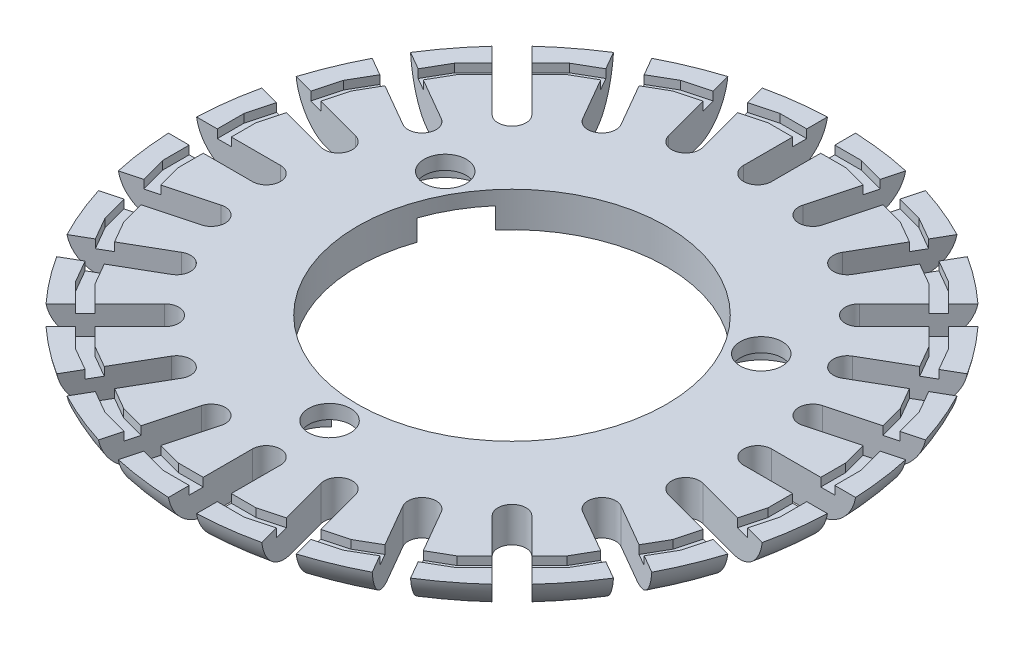
from build123d import *

# Parameters (mm, degrees)
ESBO_O1_R                = 23.5
RESSALTO_EXTRUS_O1_DEPTH = 2.5
FILETE1_R                = 3
CORTE_EXTRUS_O1_DEPTH    = 34.327916234
PADR_OCIRCULAR1_COUNT    = 24
CORTE_EXTRUS_O2_DEPTH    = 0.6
PADR_OCIRCULAR2_COUNT    = 24
ESBO_O5_R                = 11
CORTE_EXTRUS_O3_DEPTH    = 34.29789798
ESBO_O6_R                = 1.5
CORTE_EXTRUS_O5_DEPTH    = 2.5
ESBO_O8_R                = 3
CORTE_EXTRUS_O6_DEPTH    = 1.5


with BuildPart() as part:
    # Esboço1 → Ressalto-extrusão1 (new body)
    with BuildSketch(Plane(origin=(0, 0, 0), x_dir=(1, 0, 0), z_dir=(0, 1, 0))):
        with Locations(Location((0, 0, 0), (0, 0, 270))):
            Circle(ESBO_O1_R)
    extrude(amount=RESSALTO_EXTRUS_O1_DEPTH)

    # Filete1
    # the kernel refuses this fillet: 3 mm, written as the material it takes off along each edge
    with BuildSketch(Plane(origin=(0, 0, 0), x_dir=(0, 0, 1), z_dir=(-1, 0, 0))) as filete1_piece_1:
        with BuildLine():
            CenterArc((20.541960108, 3), FILETE1_R, 270, 80.405931773)
            Line((20.541960108, 0), (20.541960108, -0.06))
            Line((20.541960108, -0.06), (23.5, -0.06))
            Line((23.5, -0.06), (23.56, 0))
            ThreePointArc((23.56, 0), (23.56, 1.25), (23.559160798, 2.49))
            Line((23.559160798, 2.49), (23.5, 2.5))
        make_face()
    revolve(axis=Axis((0, 0, 0), (0, 1, 0)), mode=Mode.SUBTRACT)

    # Esboço2 → Corte-extrusão1 (cut, through all)
    with BuildSketch(Plane(origin=(0, 2.5, 0), x_dir=(1, 0, 0), z_dir=(0, 1, 0))):
        with BuildLine():
            Line((1, 17.5), (1, 23.5))
            Line((1, 23.5), (-1, 23.5))
            Line((-1, 23.5), (-1, 17.5))
            ThreePointArc((-1, 17.5), (0, 16.5), (1, 17.5))
        make_face()
    corte_extrus_o1 = extrude(amount=-CORTE_EXTRUS_O1_DEPTH, mode=Mode.SUBTRACT)

    # PadrãoCircular1: Corte-extrusão1 ×24 about axis
    padr_ocircular1_axis = Axis((0, 0, 0), (0, 1, 0))
    for i in range(1, PADR_OCIRCULAR1_COUNT):
        add(corte_extrus_o1.rotate(padr_ocircular1_axis, i * 360 / PADR_OCIRCULAR1_COUNT), mode=Mode.SUBTRACT)

    # Esboço4 → Corte-extrusão2 (cut)
    with BuildSketch(Plane(origin=(0, 2.5, 0), x_dir=(1, 0, 0), z_dir=(0, 1, 0))):
        Polygon((-2.896354947, 22), (2.896354947, 22), (2.764702449, 21), (-2.764702449, 21), align=None)
    corte_extrus_o2 = extrude(amount=-CORTE_EXTRUS_O2_DEPTH, mode=Mode.SUBTRACT)

    # PadrãoCircular2: Corte-extrusão2 ×24 about axis
    padr_ocircular2_axis = Axis((0, 0, 0), (0, 1, 0))
    for i in range(1, PADR_OCIRCULAR2_COUNT):
        add(corte_extrus_o2.rotate(padr_ocircular2_axis, i * 360 / PADR_OCIRCULAR2_COUNT), mode=Mode.SUBTRACT)

    # Esboço5 → Corte-extrusão3 (cut, through all)
    with BuildSketch(Plane(origin=(0, 2.5, 0), x_dir=(1, 0, 0), z_dir=(0, 1, 0))):
        with Locations(Location((0, 0, 0), (0, 0, 270))):
            Circle(ESBO_O5_R)
    extrude(amount=-CORTE_EXTRUS_O3_DEPTH, mode=Mode.SUBTRACT)

    # Esboço6 → Corte-extrusão5 (cut)
    with BuildSketch(Plane(origin=(0, 2.5, 0), x_dir=(1, 0, 0), z_dir=(0, 1, 0))):
        with Locations(Location((-11.258330249, 6.5, 0), (0, 0, 270))):
            Circle(ESBO_O6_R)
        with Locations(Location((11.258330249, 6.5, 0), (0, 0, 270))):
            Circle(ESBO_O6_R)
        with Locations(Location((0, -13, 0), (0, 0, 270))):
            Circle(ESBO_O6_R)
    extrude(amount=-CORTE_EXTRUS_O5_DEPTH, mode=Mode.SUBTRACT)

    # Esboço8 → Corte-extrusão6 (cut)
    with BuildSketch(Plane(origin=(0, 0, 0), x_dir=(-1, 0, 0), z_dir=(0, -1, 0))):
        with Locations((11.258330249, 6.5)):
            Circle(ESBO_O8_R)
        with Locations((-11.258330249, 6.5)):
            Circle(ESBO_O8_R)
        with Locations((0, -13)):
            Circle(ESBO_O8_R)
    extrude(amount=-CORTE_EXTRUS_O6_DEPTH, mode=Mode.SUBTRACT)


solid = part.part
